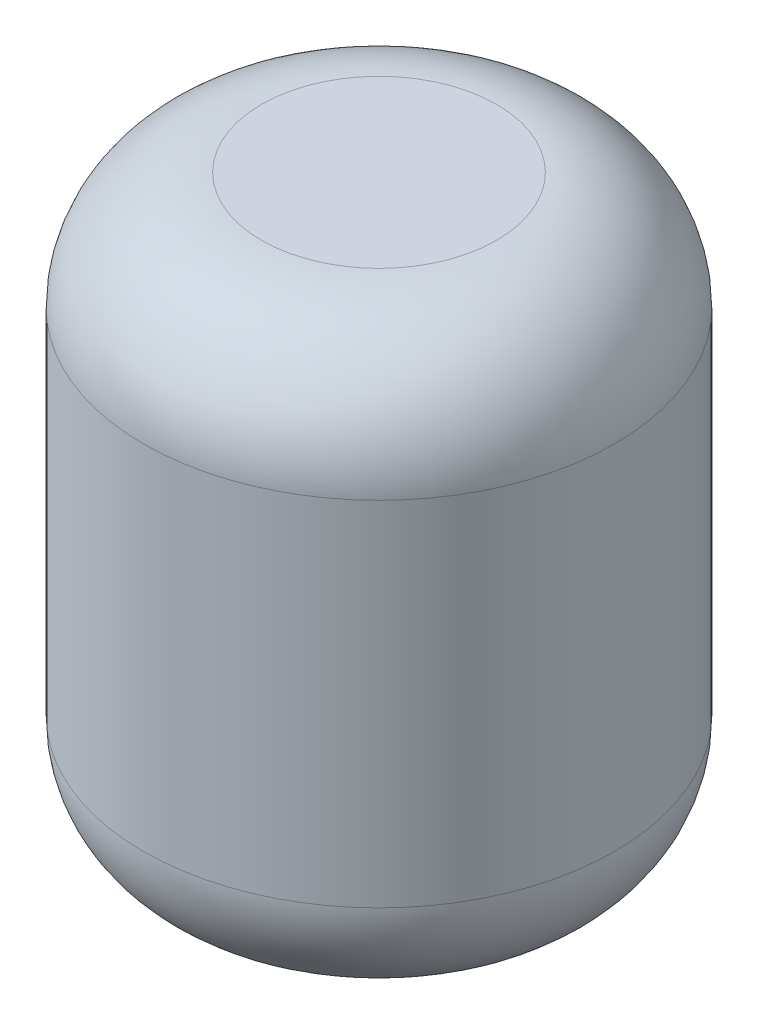
from build123d import *

# Parameters (mm, degrees)
SKETCH1_R           = 50.8
BOSS_EXTRUDE1_DEPTH = 127
FILLET1_R           = 25.4
FILLET2_R           = 25.4


with BuildPart() as part:
    # Sketch1 → Boss-Extrude1 (new body)
    with BuildSketch(Plane(origin=(0, 0, 0), x_dir=(1, 0, 0), z_dir=(0, 1, 0))):
        Circle(SKETCH1_R)
    extrude(amount=BOSS_EXTRUDE1_DEPTH)

    # Fillet1
    fillet1_edges = [part.edges().sort_by_distance(p)[0] for p in [
        (-50.8, 127, 0),
    ]]
    fillet(fillet1_edges, radius=FILLET1_R)

    # Fillet2
    fillet2_edges = [part.edges().sort_by_distance(p)[0] for p in [
        (-50.8, 0, 0),
    ]]
    fillet(fillet2_edges, radius=FILLET2_R)


solid = part.part
